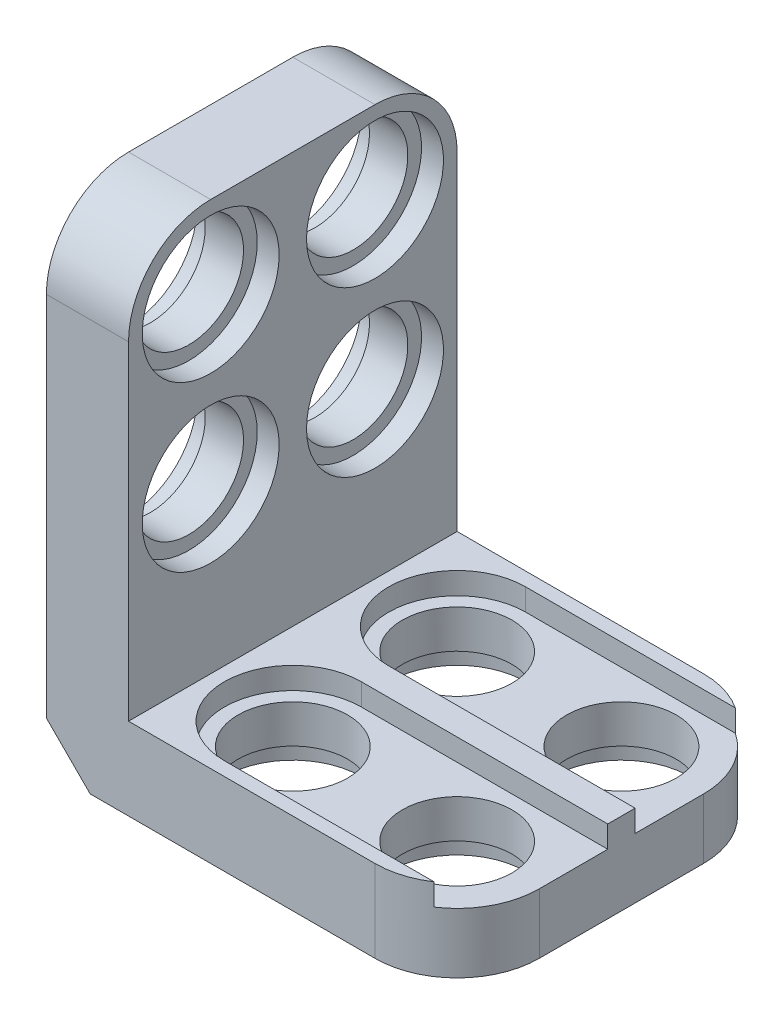
from build123d import *

# Parameters (mm, degrees)
BOSS_EXTRUDE1_DEPTH = 6
HOLE1_D             = 4
HOLE1_DEPTH         = 3
HOLE1_CBORE_D       = 5
HOLE1_CBORE_DEPTH   = 0.8
HOLE1_TIP           = 1.201721238
HOLE2_D             = 4
HOLE2_DEPTH         = 18
HOLE2_CBORE_D       = 5
HOLE2_CBORE_DEPTH   = 0.8
HOLE2_TIP           = 1.201721238
CUT_EXTRUDE1_START  = -0.8
CUT_EXTRUDE1_DEPTH  = 0.8
CUT_EXTRUDE2_DEPTH  = 0.8
CUT_EXTRUDE3_START  = -0.8
SKETCH8_R           = 2.5
CUT_EXTRUDE3_DEPTH  = 0.8
CHAMFER1_START      = -12
CHAMFER1_OUTLINE_W  = 5
CHAMFER1_OUTLINE_H  = 6
CHAMFER1_DEPTH      = 2.524769132
FILLET1_R           = 3


with BuildPart() as part:
    # Sketch1 → Boss-Extrude1 (new body)
    with BuildSketch(Plane.XY):
        Polygon((0, 0), (-15, 0), (-15, 18), (-12, 18), (-12, 3), (0, 3), align=None)
    extrude(amount=BOSS_EXTRUDE1_DEPTH)

    # Hole1
    with Locations(Plane(origin=(-12, 0, 0), x_dir=(0, 0, -1), z_dir=(1, 0, 0))):
        with Locations((-3, 9), (-3, 15)):
            CounterBoreHole(HOLE1_D / 2, HOLE1_CBORE_D / 2, HOLE1_CBORE_DEPTH, depth=HOLE1_DEPTH)
            with Locations((0, 0, -(HOLE1_DEPTH + HOLE1_TIP / 2))):  # 118° drill point
                Cone(0, HOLE1_D / 2, HOLE1_TIP, mode=Mode.SUBTRACT)

    # Hole2
    with Locations(Plane(origin=(0, 0, 0), x_dir=(-1, 0, 0), z_dir=(0, -1, 0))):
        with Locations((9, -3), (3, -3)):
            CounterBoreHole(HOLE2_D / 2, HOLE2_CBORE_D / 2, HOLE2_CBORE_DEPTH, depth=HOLE2_DEPTH)
            with Locations((0, 0, -(HOLE2_DEPTH + HOLE2_TIP / 2))):  # 118° drill point
                Cone(0, HOLE2_D / 2, HOLE2_TIP, mode=Mode.SUBTRACT)

    # Sketch6 → Cut-Extrude1 (cut)
    with BuildSketch(Plane(origin=(0, 3, 0), x_dir=(1, 0, 0), z_dir=(0, 1, 0)).offset(CUT_EXTRUDE1_START)):
        with BuildLine():
            Line((-9, -0.5), (0, -0.5))
            Line((0, -0.5), (0, -5.5))
            Line((0, -5.5), (-9, -5.5))
            ThreePointArc((-9, -5.5), (-11.5, -3), (-9, -0.5))
        make_face()
    extrude(amount=CUT_EXTRUDE1_DEPTH, mode=Mode.SUBTRACT)

    # Sketch7 → Cut-Extrude2 (cut)
    with BuildSketch(Plane.XZ):
        with BuildLine():
            Line((-15, 5.35), (-15, 0.65))
            ThreePointArc((-15, 0.65), (-12.65, 3), (-15, 5.35))
        make_face()
    extrude(amount=-CUT_EXTRUDE2_DEPTH, mode=Mode.SUBTRACT)

    # Sketch8 → Cut-Extrude3 (cut)
    with BuildSketch(Plane.ZY.offset(15).offset(CUT_EXTRUDE3_START)):
        with Locations(Location((3, 9, 0), (0, 0, 180))):
            Circle(SKETCH8_R)
        with Locations(Location((3, 15, 0), (0, 0, 180))):
            Circle(SKETCH8_R)
        with BuildLine():
            Line((0.5, 3), (0.5, 0))
            Line((0.5, 0), (5.5, 0))
            Line((5.5, 0), (5.5, 3))
            ThreePointArc((5.5, 3), (3, 5.5), (0.5, 3))
        make_face()
    extrude(amount=CUT_EXTRUDE3_DEPTH, mode=Mode.SUBTRACT)

    # Chamfer1: read off the stored shape, not the designer's step
    # Chamfer1 outline → Chamfer1 (cut)
    with BuildSketch(Plane(origin=(0, 0, 0), x_dir=(0.707106781186546, -0.707106781186549, 0), z_dir=(0.707106781186549, 0.707106781186546, 0)).offset(CHAMFER1_START)):
        with Locations((-10.5, -3)):
            Rectangle(CHAMFER1_OUTLINE_W, CHAMFER1_OUTLINE_H)
    extrude(amount=CHAMFER1_DEPTH, mode=Mode.SUBTRACT)

    # Fillet1
    fillet1_edges = [part.edges().sort_by_distance(p)[0] for p in [
        (0, 1.5, 6),
        (-13.5, 18, 6),
    ]]
    fillet(fillet1_edges, radius=FILLET1_R)

    # Mirror1: part across plane


with BuildPart() as part_1:
    add(part.part)
    add(part.part.mirror(Plane.XY))


solid = part_1.part
